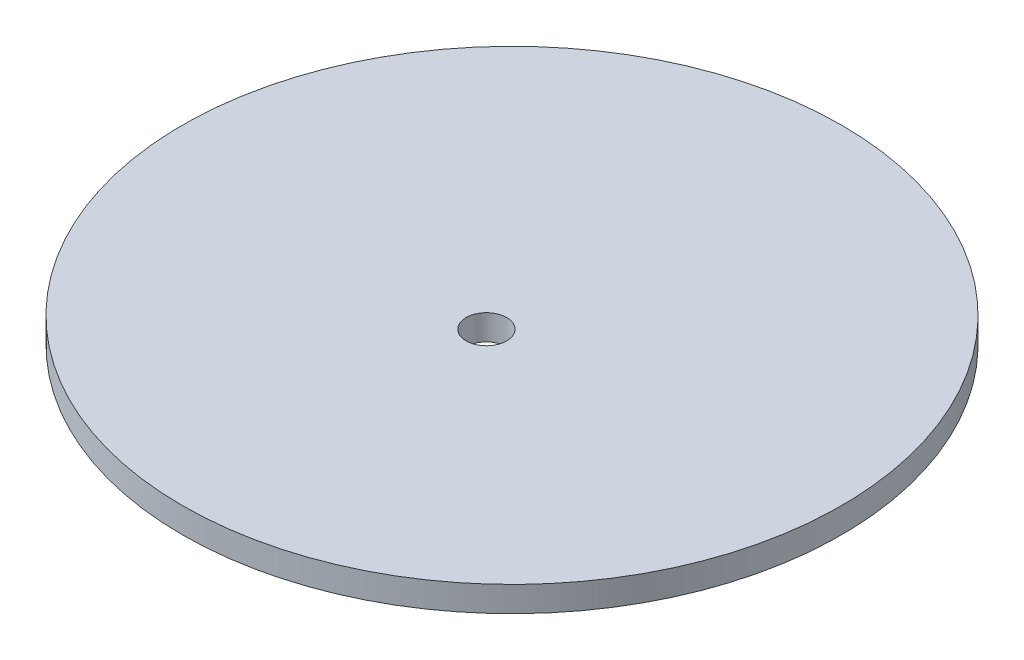
from build123d import *

# Parameters (mm, degrees)
SKETCH1_R           = 65
BOSS_EXTRUDE1_DEPTH = 5
HOLE1_OUTLINE_R     = 4
HOLE1_DEPTH         = 5


# Read off the part's stored shape, not the designer's step: Hole1
with BuildPart() as part:
    # Sketch1 → Boss-Extrude1 (new body)
    with BuildSketch(Plane(origin=(0, 0, 0), x_dir=(1, 0, 0), z_dir=(0, 1, 0))):
        with Locations(Location((0, 0, 0), (0, 0, 270))):
            Circle(SKETCH1_R)
    extrude(amount=BOSS_EXTRUDE1_DEPTH)

    # Hole1 outline → Hole1 (cut)
    with BuildSketch(Plane(origin=(0, 0, 0), x_dir=(1, 0, 0), z_dir=(0, 1, 0))):
        with Locations((-0.157021517, -4.890725438)):
            Circle(HOLE1_OUTLINE_R)
    extrude(amount=HOLE1_DEPTH, mode=Mode.SUBTRACT)


solid = part.part
